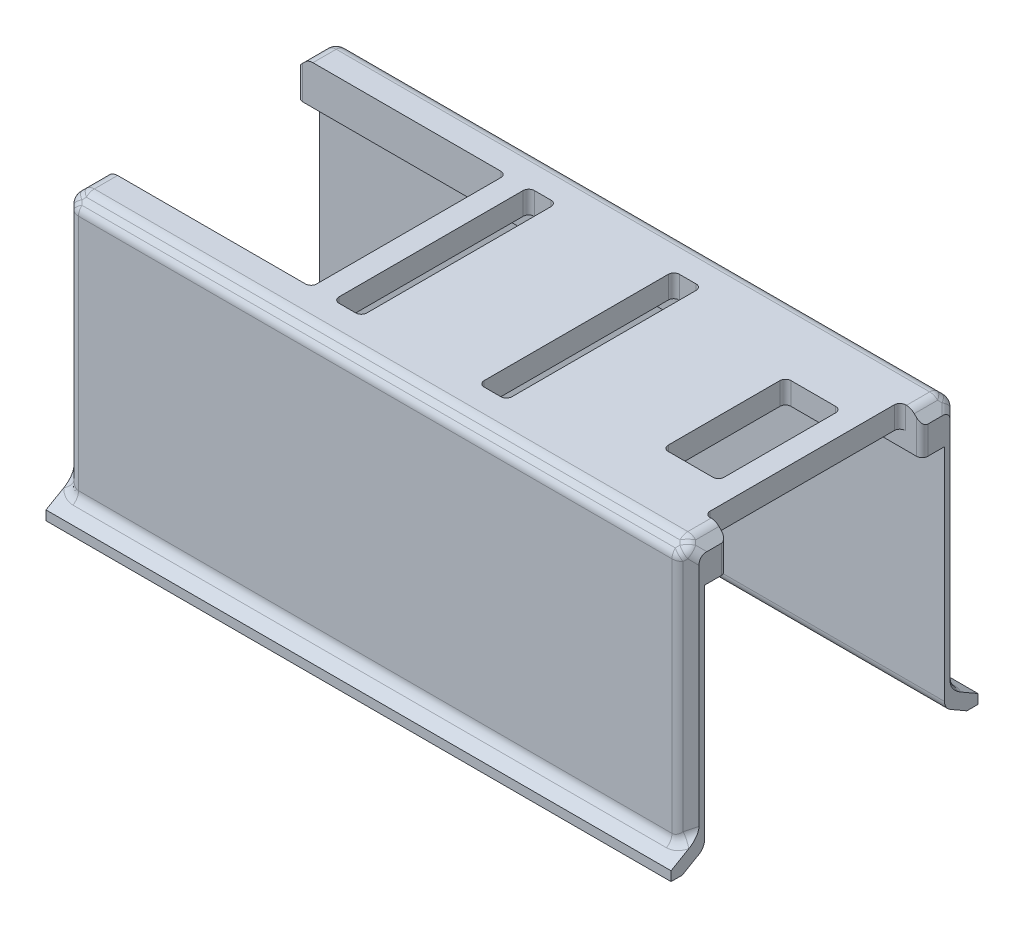
from build123d import *

# Parameters (mm, degrees)
SKETCH1_W           = 56
SKETCH1_H           = 2
SKETCH1_H_2         = 1.5
BOSS_EXTRUDE1_DEPTH = 3.5
BOSS_EXTRUDE2_START = 1.5
SKETCH1_4_W         = 2
SKETCH1_4_H         = 17.5
SKETCH1_4_W_2       = 10.5
SKETCH1_4_W_3       = 17.75
SKETCH1_4_W_4       = 5
SKETCH1_4_H_2       = 11
BOSS_EXTRUDE2_DEPTH = 2
SKETCH1_5_W         = 56
SKETCH1_5_H         = 1.5
BOSS_EXTRUDE3_DEPTH = 21.5
BOSS_EXTRUDE4_START = -21.5
SKETCH1_6_W         = 56
SKETCH1_6_H         = 1.5
BOSS_EXTRUDE4_DEPTH = 2
CHAMFER1_SIZE       = 1
CHAMFER2_SIZE       = 2
CHAMFER2_SIZE_2     = 1.154700538
CHAMFER3_SIZE       = 1
FILLET1_R           = 1
FILLET2_R           = 0.5


# Some blends are built 0.0001 mm under size
with BuildPart() as part:
    # Sketch1 → Boss-Extrude1 (new body)
    with BuildSketch(Plane(origin=(0, 0, 0), x_dir=(1, 0, 0), z_dir=(0, 1, 0))):
        with Locations((28, 9.75)):
            Rectangle(SKETCH1_W, SKETCH1_H)
        with Locations((28, -9.75)):
            Rectangle(SKETCH1_W, SKETCH1_H)
        with Locations((28, 11.5)):
            Rectangle(SKETCH1_W, SKETCH1_H_2)
        with Locations((28, -11.5)):
            Rectangle(SKETCH1_W, SKETCH1_H_2)
    extrude(amount=BOSS_EXTRUDE1_DEPTH)

    # Sketch1<4> → Boss-Extrude2 (add)
    # profile 1 of 3: a face of its own
    with BuildSketch(Plane(origin=(0, 0, 0), x_dir=(1, 0, 0), z_dir=(0, 1, 0)).offset(BOSS_EXTRUDE2_START)):
        with Locations((19.75, 0)):
            Rectangle(SKETCH1_4_W, SKETCH1_4_H)
    # profile 2 of 3: a face of its own
    with BuildSketch(Plane(origin=(0, 0, 0), x_dir=(1, 0, 0), z_dir=(0, 1, 0)).offset(BOSS_EXTRUDE2_START)):
        with Locations((28.5, 0)):
            Rectangle(SKETCH1_4_W_2, SKETCH1_4_H)
    # profile 3 of 3: a face of its own
    with BuildSketch(Plane(origin=(0, 0, 0), x_dir=(1, 0, 0), z_dir=(0, 1, 0)).offset(BOSS_EXTRUDE2_START)):
        with Locations((45.125, 0)):
            Rectangle(SKETCH1_4_W_3, SKETCH1_4_H)
        with Locations((49.5, 0)):
            Rectangle(SKETCH1_4_W_4, SKETCH1_4_H_2, mode=Mode.SUBTRACT)
    extrude(amount=BOSS_EXTRUDE2_DEPTH)

    # Sketch1<5> → Boss-Extrude3 (add)
    with BuildSketch(Plane(origin=(0, 0, 0), x_dir=(1, 0, 0), z_dir=(0, 1, 0))):
        with Locations((28, -11.5)):
            Rectangle(SKETCH1_5_W, SKETCH1_5_H)
        with Locations((28, 11.5)):
            Rectangle(SKETCH1_5_W, SKETCH1_5_H)
    extrude(amount=-BOSS_EXTRUDE3_DEPTH)

    # Sketch1<6> → Boss-Extrude4 (add)
    with BuildSketch(Plane(origin=(0, 0, 0), x_dir=(1, 0, 0), z_dir=(0, 1, 0)).offset(BOSS_EXTRUDE4_START)):
        with Locations((28, -13)):
            Rectangle(SKETCH1_6_W, SKETCH1_6_H)
        with Locations((28, 13)):
            Rectangle(SKETCH1_6_W, SKETCH1_6_H)
    extrude(amount=BOSS_EXTRUDE4_DEPTH)

    # Chamfer1
    chamfer1_edges = [part.edges().sort_by_distance(p)[0] for p in [
        (28, 3.5, -12.25),
        (0, 3.5, -10.5),
        (0, 3.5, 10.5),
        (28, 3.5, 12.25),
        (56, 3.5, 10.5),
        (56, 3.5, -10.5),
    ]]
    chamfer(chamfer1_edges, length=CHAMFER1_SIZE)

    # Chamfer2
    # the kernel refuses this chamfer: 2, 1.154700538 mm, written as the material it takes off along each edge
    with BuildSketch(Plane(origin=(-5.174171509, -19.5, 13.75), x_dir=(0, 0.01932676561270029, -0.9998132206222079), z_dir=(1, 0, 0))) as chamfer2_piece_1_section:
        Polygon((CHAMFER2_SIZE * 0.999813220622, -CHAMFER2_SIZE * 0.0193267656127), (-CHAMFER2_SIZE_2 * 0.019326765619, -CHAMFER2_SIZE_2 * 0.999813220951), (0, 0), align=None)
    chamfer2_piece_1 = extrude(amount=66.348343019, mode=Mode.PRIVATE)
    chamfer2_piece_1 = split(chamfer2_piece_1, bisect_by=Plane(origin=(28, -19.898789349, 12.25), z_dir=(0, 0, 1)), keep=Keep.TOP, mode=Mode.PRIVATE)
    add(chamfer2_piece_1, mode=Mode.SUBTRACT)
    with BuildSketch(Plane(origin=(61.174171509, -19.5, -13.75), x_dir=(0, 0.01932676561270029, 0.9998132206222079), z_dir=(-1, 0, 0))) as chamfer2_piece_2_section:
        Polygon((CHAMFER2_SIZE * 0.999813220622, -CHAMFER2_SIZE * 0.0193267656127), (-CHAMFER2_SIZE_2 * 0.019326765619, -CHAMFER2_SIZE_2 * 0.999813220951), (0, 0), align=None)
    chamfer2_piece_2 = extrude(amount=66.348343019, mode=Mode.PRIVATE)
    chamfer2_piece_2 = split(chamfer2_piece_2, bisect_by=Plane(origin=(28, -19.898789349, -12.25), z_dir=(0, 0, -1)), keep=Keep.TOP, mode=Mode.PRIVATE)
    add(chamfer2_piece_2, mode=Mode.SUBTRACT)
    with BuildSketch(Plane(origin=(-5.174171509, -21.5, 10.75), x_dir=(0, 0.9983227437537925, -0.0578938624026711), z_dir=(1, 0, 0)), Plane(origin=(61.174171509, -21.5, -10.75), x_dir=(0, 0.9983227437537925, 0.0578938624026711), z_dir=(-1, 0, 0))) as chamfer2_piece_3:
        Polygon((CHAMFER2_SIZE_2 * 0.998322744082, CHAMFER2_SIZE_2 * 0.0578938624217), (-CHAMFER2_SIZE * 0.0578938624027, CHAMFER2_SIZE * 0.998322743754), (0, 0), align=None)
    extrude(amount=66.348343019, mode=Mode.SUBTRACT)

    # Chamfer3
    chamfer3_edges = [part.edges().sort_by_distance(p)[0] for p in [
        (56, -8.644337567, -12.25),
        (0, -8.644337567, -12.25),
        (56, -8.644337567, 12.25),
        (0, -8.644337567, 12.25),
    ]]
    chamfer(chamfer3_edges, length=CHAMFER3_SIZE)

    # Fillet1
    fillet1_edges = [part.edges().sort_by_distance(p)[0] for p in [
        (28, 3.5, 11.25),
        (1, 3.5, 10),
        (55, 3.5, 10),
        (1, 3.5, -10),
        (28, 3.5, -11.25),
        (55, 3.5, -10),
        (0.75, 3.25, 11.5),
        (55.25, 3.25, 11.5),
        (28, -20.345299462, 10.75),
        (28, -20.345299462, -10.75),
        (28, 2.5, 12.25),
        (28, -19.788675135, 12.25),
        (1, -8.644337567, 12.25),
        (55, -8.644337567, 12.25),
        (0.75, 2.75, 12),
        (55.25, 2.75, 12),
        (55.75, 2.75, 11.5),
        (0.25, 2.75, 11.5),
        (28, 2.5, -12.25),
        (28, -19.788675135, -12.25),
        (55, -8.644337567, -12.25),
        (1, -8.644337567, -12.25),
        (0.75, 3.25, -11.5),
        (55.25, 3.25, -11.5),
        (55.25, 2.75, -12),
        (0.75, 2.75, -12),
        (0.25, 2.75, -11.5),
        (55.75, 2.75, -11.5),
        (55.5, -19.5, 11.75),
        (0.5, -19.5, 11.75),
        (0.5, -19.5, -11.75),
        (55.5, -19.5, -11.75),
    ]]
    fillet(fillet1_edges, radius=FILLET1_R - 0.0001)  # a hair under: the kernel refuses the full size

    # Fillet2
    fillet2_edges = [part.edges().sort_by_distance(p)[0] for p in [
        (56, 1.25, -8.75),
        (0, 1.25, -8.75),
        (56, 1.25, 8.75),
        (0, 1.25, 8.75),
        (20.75, 2.5, 8.75),
        (20.75, 2.5, -8.75),
        (18.75, 2.5, -8.75),
        (18.75, 2.5, 8.75),
        (33.75, 2.5, 8.75),
        (33.75, 2.5, -8.75),
        (23.25, 2.5, -8.75),
        (23.25, 2.5, 8.75),
        (36.25, 2.5, 8.75),
        (36.25, 2.5, -8.75),
        (54, 2.5, -8.75),
        (54, 2.5, 8.75),
        (47, 2.5, 5.5),
        (52, 2.5, 5.5),
        (52, 2.5, -5.5),
        (47, 2.5, -5.5),
    ]]
    fillet(fillet2_edges, radius=FILLET2_R)


solid = part.part
